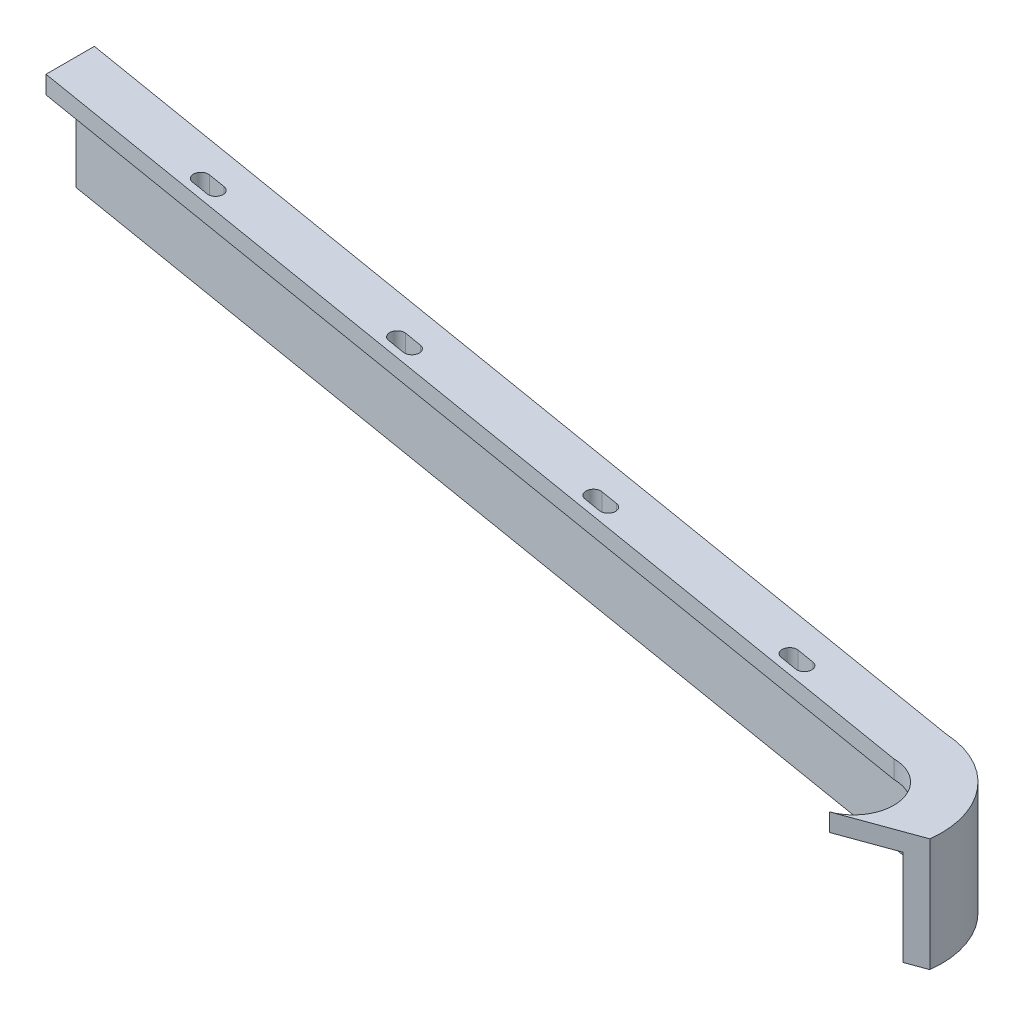
from build123d import *

# Parameters (mm, degrees)
SKETCH_1_W           = 35
SKETCH_1_H           = 55
EXTRUDE_1_DEPTH      = 1
EXTRUDE_2_DEPTH      = 3
SKETCH_3_R           = 5
CUT_EXTRUDE_1_DEPTH  = 169.569903897
SKETCH_4_R           = 4
CUT_EXTRUDE_2_DEPTH  = 2
SKETCH_5_R           = 2
CUT_EXTRUDE_3_DEPTH  = 2
EXTRUDE_START        = 7
EXTRUDE_3_DEPTH      = 7
CUT_EXTRUDE_START    = -1.5
SKETCH_9_W           = 10
SKETCH_9_H           = 26
CUT_EXTRUDE_4_DEPTH  = 168.318874833
SKETCH_10_R          = 1.5
CUT_EXTRUDE_5_DEPTH  = 194.595583627
EXTRUDE_4_DEPTH      = 3
SKETCH_13_W          = 334.012533363
SKETCH_13_H          = 161.456209481
CUT_EXTRUDE_6_DEPTH  = 10
SKETCH_14_R          = 3.5
CUT_EXTRUDE_7_DEPTH  = 2.5
SKETCH_15_R          = 5
CUT_EXTRUDE_8_DEPTH  = 179.854165453
EXTRUDE_START_2      = 16
EXTRUDE_5_DEPTH      = 16
EXTRUDE_6_DEPTH      = 7
SKETCH_19_W          = 10
SKETCH_19_H          = 26
CUT_EXTRUDE_9_DEPTH  = 180.209193181
SKETCH_20_R          = 1.5
CUT_EXTRUDE_10_DEPTH = 175.844216376
THREAD_1_PITCH       = 0.6
CUT_EXTRUDE_11_DEPTH = 181.709193232
SKETCH_22_W          = 13
SKETCH_22_H          = 1.5
CUT_EXTRUDE_12_DEPTH = 7
SKETCH_23_R          = 5
EXTRUDE_7_DEPTH      = 2
CUT_EXTRUDE_START_2  = -3
CUT_EXTRUDE_15_DEPTH = 177.762490825
SKETCH_25_R          = 7.5
CUT_EXTRUDE_16_DEPTH = 4
CUT_EXTRUDE_17_DEPTH = 10
SKETCH_27_R          = 1.75
CUT_EXTRUDE_18_DEPTH = 10
CUT_EXTRUDE_19_DEPTH = 180.762490825
CUT_EXTRUDE_START_3  = -10
SKETCH_29_R          = 3.5
CUT_EXTRUDE_23_DEPTH = 10
CUT_EXTRUDE_24_DEPTH = 10


with BuildPart() as part:
    # Sketch 1 → 凸台-拉伸1 (new body)
    with BuildSketch(Plane(origin=(0, 0, 0), x_dir=(1, 0, 0), z_dir=(0, 1, 0))):
        Rectangle(SKETCH_1_W, SKETCH_1_H)
    extrude(amount=EXTRUDE_1_DEPTH)

    # 草图2 → 凸台-拉伸2 (add)
    with BuildSketch(Plane(origin=(0, 1, 0), x_dir=(1, 0, 0), z_dir=(0, 1, 0))):
        with BuildLine():
            Line((106.75, -2.25), (106.75, 2.25))
            Line((106.75, 2.25), (121.75, 2.25))
            ThreePointArc((121.75, 2.25), (122.922125199, 2.352547667), (124.058635967, 2.65707481))
            Line((124.058635967, 2.65707481), (154.058635967, 13.576181838))
            ThreePointArc((154.058635967, 13.576181838), (158.397452333, 21.091232227), (151.75, 26.669107028))
            Line((151.75, 26.669107028), (-31.447415548, 57.101298968))
            ThreePointArc((-31.447415548, 57.101298968), (-37.800418235, 56.264673928), (-42.609265279, 52.029632639))
            Line((-42.609265279, 52.029632639), (-60.161792173, 23.605896086))
            ThreePointArc((-60.161792173, 23.605896086), (-61.717833724, 20.073278016), (-62.25, 16.25))
            Line((-62.25, 16.25), (-62.25, -16.25))
            ThreePointArc((-62.25, -16.25), (-61.717833724, -20.073278016), (-60.161792173, -23.605896086))
            Line((-60.161792173, -23.605896086), (-42.609265279, -52.029632639))
            ThreePointArc((-42.609265279, -52.029632639), (-37.800418235, -56.264673928), (-31.447415548, -57.101298968))
            Line((-31.447415548, -57.101298968), (151.75, -26.669107028))
            ThreePointArc((151.75, -26.669107028), (158.397452333, -21.091232227), (154.058635967, -13.576181838))
            Line((154.058635967, -13.576181838), (124.058635967, -2.65707481))
            ThreePointArc((124.058635967, -2.65707481), (122.922125199, -2.352547667), (121.75, -2.25))
            Line((121.75, -2.25), (106.75, -2.25))
        make_face()
    extrude(amount=EXTRUDE_2_DEPTH)

    # 草图3 → 切除-拉伸1 (cut, through all)
    with BuildSketch(Plane(origin=(0, 4, 0), x_dir=(1, 0, 0), z_dir=(0, 1, 0))):
        with Locations(Location((-48.25, 16.25, 0), (0, 0, 270))):
            Circle(SKETCH_3_R)
        with Locations(Location((-48.25, -16.25, 0), (0, 0, 270))):
            Circle(SKETCH_3_R)
    extrude(amount=-CUT_EXTRUDE_1_DEPTH, mode=Mode.SUBTRACT)

    # 草图4 → 切除-拉伸2 (cut)
    with BuildSketch(Plane(origin=(0, 4, 0), x_dir=(1, 0, 0), z_dir=(0, 1, 0))):
        with Locations(Location((-33.25, 46.25, 0), (0, 0, 270))):
            Circle(SKETCH_4_R)
        with Locations(Location((-33.25, -46.25, 0), (0, 0, 270))):
            Circle(SKETCH_4_R)
    extrude(amount=-CUT_EXTRUDE_2_DEPTH, mode=Mode.SUBTRACT)

    # 草图5 → 切除-拉伸3 (cut)
    with BuildSketch(Plane(origin=(0, 4, 0), x_dir=(1, 0, 0), z_dir=(0, 1, 0))):
        with Locations(Location((121.75, 9, 0), (0, 0, 270))):
            Circle(SKETCH_5_R)
        with Locations(Location((121.75, -9, 0), (0, 0, 270))):
            Circle(SKETCH_5_R)
        with Locations(Location((151.75, 19.919107028, 0), (0, 0, 270))):
            Circle(SKETCH_5_R)
        with Locations(Location((151.75, -19.919107028, 0), (0, 0, 270))):
            Circle(SKETCH_5_R)
    extrude(amount=-CUT_EXTRUDE_3_DEPTH, mode=Mode.SUBTRACT)

    # 草图8 → 凸台-拉伸3 (add)
    with BuildSketch(Plane.XZ.offset(-1).offset(EXTRUDE_START)):
        with BuildLine():
            Line((-26.75, -26.25), (-39.75, -26.25))
            Line((-39.75, -26.25), (-39.75, -55.124119675))
            ThreePointArc((-39.75, -55.124119675), (-35.798281322, -56.950759894), (-31.447415548, -57.101298968))
            Line((-31.447415548, -57.101298968), (-26.75, -56.320978726))
            Line((-26.75, -56.320978726), (-26.75, -26.25))
        make_face()
    extrude_3 = extrude(amount=-EXTRUDE_3_DEPTH)

    # 镜向1: 凸台-拉伸3 across plane
    add(extrude_3.mirror(Plane.XY))

    # 草图9 → 切除-拉伸4 (cut, through all)
    with BuildSketch(Plane.XZ.offset(6).offset(CUT_EXTRUDE_START)):
        with Locations((-33.25, -40.75)):
            Rectangle(SKETCH_9_W, SKETCH_9_H)
    cut_extrude_4 = extrude(amount=-CUT_EXTRUDE_4_DEPTH, mode=Mode.SUBTRACT)

    # 镜向2: 切除-拉伸4 across plane
    add(cut_extrude_4.mirror(Plane.XY), mode=Mode.SUBTRACT)

    # 草图10 → 切除-拉伸5 (cut, through all)
    with BuildSketch(Plane.XY.offset(-53.75)):
        with Locations((-33.25, -1.5)):
            Circle(SKETCH_10_R)
    cut_extrude_5 = extrude(amount=-CUT_EXTRUDE_5_DEPTH, mode=Mode.SUBTRACT)

    # 镜向3: 切除-拉伸5 across plane
    add(cut_extrude_5.mirror(Plane.XY), mode=Mode.SUBTRACT)

    # 草图12 → 凸台-拉伸4 (add)
    with BuildSketch(Plane(origin=(0, 4, 0), x_dir=(1, 0, 0), z_dir=(0, 1, 0))):
        with BuildLine():
            Line((152.536154407, 34.648141662), (-30.136445037, 64.993152763))
            ThreePointArc((-30.136445037, 64.993152763), (-32.296727103, 65.226071005), (-34.469475839, 65.210824842))
            Line((-34.469475839, 65.210824842), (-60.161792173, 23.605896086))
            ThreePointArc((-60.161792173, 23.605896086), (-61.717833724, 20.073278016), (-62.25, 16.25))
            Line((-62.25, 16.25), (-62.25, 2.25))
            Line((-62.25, 2.25), (121.75, 2.25))
            ThreePointArc((121.75, 2.25), (122.922125199, 2.352547667), (124.058635967, 2.65707481))
            Line((124.058635967, 2.65707481), (166.382589153, 18.061733966))
            ThreePointArc((166.382589153, 18.061733966), (163.073058037, 29.371665237), (152.536154407, 34.648141662))
        make_face()
    extrude(amount=EXTRUDE_4_DEPTH)

    # 草图13 → 切除-拉伸6 (cut)
    with BuildSketch(Plane.XZ.offset(-4)):
        with Locations((47.836319436, 6.16656882)):
            Rectangle(SKETCH_13_W, SKETCH_13_H)
    extrude(amount=CUT_EXTRUDE_6_DEPTH, mode=Mode.SUBTRACT)

    # 草图14 → 切除-拉伸7 (cut)
    with BuildSketch(Plane.XZ.offset(-4)):
        with Locations(Location((151.75, -19.919107028, 0), (0, 0, 270))):
            Circle(SKETCH_14_R)
        with Locations(Location((121.75, -9, 0), (0, 0, 270))):
            Circle(SKETCH_14_R)
    extrude(amount=-CUT_EXTRUDE_7_DEPTH, mode=Mode.SUBTRACT)

    # 草图15 → 切除-拉伸8 (cut, through all)
    with BuildSketch(Plane.XZ.offset(-4)):
        with Locations(Location((-48.25, -16.25, 0), (0, 0, 270))):
            Circle(SKETCH_15_R)
    extrude(amount=-CUT_EXTRUDE_8_DEPTH, mode=Mode.SUBTRACT)

    # 草图17 → 凸台-拉伸5 (add)
    with BuildSketch(Plane.XZ.offset(-4).offset(EXTRUDE_START_2)):
        with BuildLine():
            Line((-30.628058978, -62.03370759), (152.218782473, -31.659751942))
            ThreePointArc((152.218782473, -31.659751942), (161.216553887, -26.879484712), (163.096310198, -16.865626245))
            Line((163.096310198, -16.865626245), (166.382589153, -18.061733966))
            ThreePointArc((166.382589153, -18.061733966), (163.073058037, -29.371665237), (152.536154407, -34.648141662))
            Line((152.536154407, -34.648141662), (-30.136445037, -64.993152763))
            ThreePointArc((-30.136445037, -64.993152763), (-32.296727103, -65.226071005), (-34.469475839, -65.210824842))
            Line((-34.469475839, -65.210824842), (-36.504423199, -61.915526791))
            ThreePointArc((-36.504423199, -61.915526791), (-33.571714316, -62.246765295), (-30.628058978, -62.03370759))
        make_face()
    extrude(amount=-EXTRUDE_5_DEPTH)

    # 草图18 → 凸台-拉伸6 (add)
    with BuildSketch(Plane(origin=(0, 7, 0), x_dir=(1, 0, 0), z_dir=(0, 1, 0))):
        with BuildLine():
            Line((-39.75, 56.65979236), (-39.75, 26.25))
            Line((-39.75, 26.25), (-26.75, 26.25))
            Line((-26.75, 26.25), (-26.75, 64.430606916))
            Line((-26.75, 64.430606916), (-30.136445037, 64.993152763))
            ThreePointArc((-30.136445037, 64.993152763), (-32.296727103, 65.226071005), (-34.469475839, 65.210824842))
            Line((-34.469475839, 65.210824842), (-39.75, 56.65979236))
        make_face()
    extrude(amount=EXTRUDE_6_DEPTH)

    # 草图19 → 切除-拉伸9 (cut, through all)
    with BuildSketch(Plane(origin=(0, 14, 0), x_dir=(1, 0, 0), z_dir=(0, 1, 0)).offset(CUT_EXTRUDE_START)):
        with Locations((-33.25, 40.75)):
            Rectangle(SKETCH_19_W, SKETCH_19_H)
    extrude(amount=-CUT_EXTRUDE_9_DEPTH, mode=Mode.SUBTRACT)

    # 草图20 → 切除-拉伸10 (cut, through all)
    with BuildSketch(Plane.XY.offset(-53.75)):
        with Locations((-33.25, 9.5)):
            Circle(SKETCH_20_R)
    extrude(amount=-CUT_EXTRUDE_10_DEPTH, mode=Mode.SUBTRACT)

    # 螺纹线1: the profile of Sketch 1 2 profile screwed along a right-hand helix of 25 turns, 6 arcs to a turn; built about Z, then put on its axis
    thread_1_z = Axis((0, 0, 0), (0, 0, 1))
    thread_1_corners = [(1.4997, 0, -0.000173205), (1.824759525, 0, 0.187499999), (1.824759525, 0, 0.262499999), (1.4997, 0, 0.450173203)]
    with BuildLine(mode=Mode.PRIVATE) as thread_1_profile:
        Line(thread_1_corners[0], thread_1_corners[1])
        Line(thread_1_corners[1], thread_1_corners[2])
        Line(thread_1_corners[2], thread_1_corners[3])
        Line(thread_1_corners[3], thread_1_corners[0])
    thread_1_cap = Face(thread_1_profile.wire())
    thread_1_turn_angles = [0, 30, 60, 90, 120, 150, 180, 210, 240, 270, 300, 330, 360]
    thread_1_turn_weights = [1, 0.8660254037844387, 1, 0.8660254037844387, 1, 0.8660254037844387, 1, 0.8660254037844387, 1, 0.8660254037844387, 1, 0.8660254037844387, 1]
    thread_1_turn_rails = [Edge.make_bspline([Vector(p[0], p[1], 0).rotate(thread_1_z, thread_1_turn_angles[k]) / thread_1_turn_weights[k] + Vector(0, 0, p[2] + THREAD_1_PITCH * thread_1_turn_angles[k] / 360) for k in range(13)], [0, 0, 0, 1, 1, 2, 2, 3, 3, 4, 4, 5, 5, 6, 6, 6], 2, thread_1_turn_weights) for p in thread_1_corners]
    thread_1_turn_sides = [Face.make_surface_from_curves(thread_1_turn_rails[p[0]], thread_1_turn_rails[p[1]]) for p in [(0, 1), (1, 2), (2, 3), (3, 0)]]
    thread_1 = Plane(origin=(-33.25, 9.5, -53.75), x_dir=(-1, 0, 0), z_dir=(0, 0, -1)) * Solid(Shell([*[p.moved(Location((0, 0, THREAD_1_PITCH * i))) for i in range(25) for p in thread_1_turn_sides], thread_1_cap, thread_1_cap.rotate(thread_1_z, 9000).moved(Location((0, 0, THREAD_1_PITCH * 9000 / 360)))]))
    add(thread_1, mode=Mode.SUBTRACT)

    # 草图21 → 切除-拉伸11 (cut, through all)
    with BuildSketch(Plane(origin=(0, 14, 0), x_dir=(1, 0, 0), z_dir=(0, 1, 0))):
        with BuildLine():
            Line((-39.75, 27.75), (-26.75, 27.75))
            Line((-26.75, 27.75), (-26.75, 64.430606916))
            Line((-26.75, 64.430606916), (-30.136445037, 64.993152763))
            ThreePointArc((-30.136445037, 64.993152763), (-32.296727103, 65.226071005), (-34.469475839, 65.210824842))
            Line((-34.469475839, 65.210824842), (-39.75, 56.65979236))
            Line((-39.75, 56.65979236), (-39.75, 27.75))
        make_face()
    extrude(amount=-CUT_EXTRUDE_11_DEPTH, mode=Mode.SUBTRACT)

    # 草图22 → 切除-拉伸12 (cut)
    with BuildSketch(Plane(origin=(0, 14, 0), x_dir=(1, 0, 0), z_dir=(0, 1, 0))):
        with Locations((-33.25, 27)):
            Rectangle(SKETCH_22_W, SKETCH_22_H)
    extrude(amount=-CUT_EXTRUDE_12_DEPTH, mode=Mode.SUBTRACT)

    # 草图23 → 凸台-拉伸7 (add)
    with BuildSketch(Plane(origin=(0, 7, 0), x_dir=(1, 0, 0), z_dir=(0, 1, 0))):
        with BuildLine():
            Line((-26.75, 27.75), (-39.75, 27.75))
            Line((-39.75, 27.75), (-39.75, 56.65979236))
            Line((-39.75, 56.65979236), (-60.161792173, 23.605896086))
            ThreePointArc((-60.161792173, 23.605896086), (-61.717833724, 20.073278016), (-62.25, 16.25))
            Line((-62.25, 16.25), (-62.25, 2.25))
            Line((-62.25, 2.25), (-18.75, 2.25))
            Line((-18.75, 2.25), (-18.75, 63.101671489))
            Line((-18.75, 63.101671489), (-26.75, 64.430606916))
            Line((-26.75, 64.430606916), (-26.75, 27.75))
        make_face()
        with Locations(Location((-48.25, 16.25, 0), (0, 0, 90))):
            Circle(SKETCH_23_R, mode=Mode.SUBTRACT)
    extrude(amount=EXTRUDE_7_DEPTH)

    # 草图24 → 切除-拉伸15 (cut, through all)
    with BuildSketch(Plane(origin=(0, 9, 0), x_dir=(1, 0, 0), z_dir=(0, 1, 0)).offset(CUT_EXTRUDE_START_2)):
        Polygon((-45.75, 46.034880297), (-45.75, 27.75), (-39.75, 27.75), (-39.75, 56.65979236), (-45.75, 46.943674541), align=None)
        Polygon((-26.75, 64.430606916), (-26.75, 27.75), (-20.75, 27.75), (-20.75, 63.433905346), align=None)
    extrude(amount=-CUT_EXTRUDE_15_DEPTH, mode=Mode.SUBTRACT)

    # 草图25 → 切除-拉伸16 (cut)
    with BuildSketch(Plane.XZ.offset(-4)):
        with Locations(Location((-48.25, -16.25, 0), (0, 0, 270))):
            Circle(SKETCH_25_R)
    extrude(amount=-CUT_EXTRUDE_16_DEPTH, mode=Mode.SUBTRACT)

    # 草图26 → 切除-拉伸17 (cut)
    with BuildSketch(Plane(origin=(0, 7, 0), x_dir=(1, 0, 0), z_dir=(0, 1, 0))):
        with BuildLine():
            Line((3.5, 31.25), (3.5, 35.25))
            ThreePointArc((3.5, 35.25), (1.75, 37), (0, 35.25))
            Line((0, 35.25), (0, 31.25))
            ThreePointArc((0, 31.25), (1.75, 29.5), (3.5, 31.25))
        make_face()
        with BuildLine():
            ThreePointArc((41.75, 18), (40.512563133, 17.487436867), (40, 16.25))
            Line((40, 16.25), (47.5, 16.25))
            ThreePointArc((47.5, 16.25), (46.987436867, 17.487436867), (45.75, 18))
            Line((45.75, 18), (41.75, 18))
        make_face()
        with BuildLine():
            Line((47.5, 16.25), (40, 16.25))
            ThreePointArc((40, 16.25), (40.512563133, 15.012563133), (41.75, 14.5))
            Line((41.75, 14.5), (45.75, 14.5))
            ThreePointArc((45.75, 14.5), (46.987436867, 15.012563133), (47.5, 16.25))
        make_face()
        with BuildLine():
            Line((81.75, 14.5), (85.75, 14.5))
            ThreePointArc((85.75, 14.5), (87.5, 16.25), (85.75, 18))
            Line((85.75, 18), (81.75, 18))
            ThreePointArc((81.75, 18), (80, 16.25), (81.75, 14.5))
        make_face()
        with BuildLine():
            Line((1.75, 18), (5.75, 18))
            ThreePointArc((5.75, 18), (7.5, 16.25), (5.75, 14.5))
            Line((5.75, 14.5), (1.75, 14.5))
            ThreePointArc((1.75, 14.5), (0, 16.25), (1.75, 18))
        make_face()
    extrude(amount=-CUT_EXTRUDE_17_DEPTH, mode=Mode.SUBTRACT)

    # 草图27 → 切除-拉伸18 (cut)
    with BuildSketch(Plane.XZ.offset(-6)):
        with Locations(Location((-42.75, -32.75, 0), (0, 0, 270))):
            Circle(SKETCH_27_R)
        with Locations(Location((-42.75, -42.75, 0), (0, 0, 270))):
            Circle(SKETCH_27_R)
        with Locations(Location((-23.75, -32.75, 0), (0, 0, 270))):
            Circle(SKETCH_27_R)
        with Locations(Location((-23.75, -42.75, 0), (0, 0, 270))):
            Circle(SKETCH_27_R)
    extrude(amount=-CUT_EXTRUDE_18_DEPTH, mode=Mode.SUBTRACT)

    # 草图28 → 切除-拉伸19 (cut, through all)
    with BuildSketch(Plane(origin=(0, 9, 0), x_dir=(1, 0, 0), z_dir=(0, 1, 0))):
        with BuildLine():
            Line((-26.75, 27.75), (-39.75, 27.75))
            Line((-39.75, 27.75), (-39.75, 56.65979236))
            Line((-39.75, 56.65979236), (-60.161792173, 23.605896086))
            ThreePointArc((-60.161792173, 23.605896086), (-61.717833724, 20.073278016), (-62.25, 16.25))
            Line((-62.25, 16.25), (-62.25, 2.25))
            Line((-62.25, 2.25), (-18.75, 2.25))
            Line((-18.75, 2.25), (-18.75, 63.101671489))
            Line((-18.75, 63.101671489), (-26.75, 64.430606916))
            Line((-26.75, 64.430606916), (-26.75, 27.75))
        make_face()
    extrude(amount=-CUT_EXTRUDE_19_DEPTH, mode=Mode.SUBTRACT)

    # 草图29 → 切除-拉伸23 (cut)
    # profile 1 of 3: a face of its own
    with BuildSketch(Plane.XZ.offset(-4).offset(CUT_EXTRUDE_START_3)):
        with BuildLine():
            Line((-18.75, -2.25), (-18.75, -54.9920433))
            Line((-18.75, -54.9920433), (151.75, -26.669107028))
            ThreePointArc((151.75, -26.669107028), (158.397452333, -21.091232227), (154.058635967, -13.576181838))
            Line((154.058635967, -13.576181838), (124.058635967, -2.65707481))
            ThreePointArc((124.058635967, -2.65707481), (122.922125199, -2.352547667), (121.75, -2.25))
            Line((121.75, -2.25), (-18.75, -2.25))
        make_face()
        with BuildLine():
            Line((0, -35.25), (0, -31.25))
            ThreePointArc((0, -31.25), (1.75, -29.5), (3.5, -31.25))
            Line((3.5, -31.25), (3.5, -35.25))
            ThreePointArc((3.5, -35.25), (1.75, -37), (0, -35.25))
        make_face(mode=Mode.SUBTRACT)
        with BuildLine():
            ThreePointArc((5.75, -14.5), (7.5, -16.25), (5.75, -18))
            Line((5.75, -18), (1.75, -18))
            ThreePointArc((1.75, -18), (0, -16.25), (1.75, -14.5))
            Line((1.75, -14.5), (5.75, -14.5))
        make_face(mode=Mode.SUBTRACT)
        with BuildLine():
            ThreePointArc((45.75, -14.5), (47.5, -16.25), (45.75, -18))
            Line((45.75, -18), (41.75, -18))
            ThreePointArc((41.75, -18), (40, -16.25), (41.75, -14.5))
            Line((41.75, -14.5), (45.75, -14.5))
        make_face(mode=Mode.SUBTRACT)
        with Locations((151.75, -19.919107028)):
            Circle(SKETCH_29_R, mode=Mode.SUBTRACT)
        with BuildLine():
            Line((85.75, -18), (81.75, -18))
            ThreePointArc((81.75, -18), (80, -16.25), (81.75, -14.5))
            Line((81.75, -14.5), (85.75, -14.5))
            ThreePointArc((85.75, -14.5), (87.5, -16.25), (85.75, -18))
        make_face(mode=Mode.SUBTRACT)
        with Locations((121.75, -9)):
            Circle(SKETCH_29_R, mode=Mode.SUBTRACT)
    # profile 2 of 3: a face of its own
    with BuildSketch(Plane.XZ.offset(-4).offset(CUT_EXTRUDE_START_3)):
        with Locations((121.75, -9)):
            Circle(SKETCH_29_R)
    # profile 3 of 3: a face of its own
    with BuildSketch(Plane.XZ.offset(-4).offset(CUT_EXTRUDE_START_3)):
        with Locations((151.75, -19.919107028)):
            Circle(SKETCH_29_R)
    extrude(amount=CUT_EXTRUDE_23_DEPTH, mode=Mode.SUBTRACT)

    # 草图30 → 切除-拉伸24 (cut)
    with BuildSketch(Plane.XZ.offset(-4)):
        with BuildLine():
            Line((9.159890002, -51.622867509), (12.119335175, -51.131253567))
            ThreePointArc((12.119335175, -51.131253567), (13.557276473, -52.15951658), (12.52901346, -53.597457878))
            Line((12.52901346, -53.597457878), (9.569568287, -54.08907182))
            ThreePointArc((9.569568287, -54.08907182), (8.131626989, -53.060808807), (9.159890002, -51.622867509))
        make_face()
        with BuildLine():
            Line((48.619158976, -45.068014955), (51.578604149, -44.576401013))
            ThreePointArc((51.578604149, -44.576401013), (53.016545447, -45.604664026), (51.988282434, -47.042605324))
            Line((51.988282434, -47.042605324), (49.028837261, -47.534219265))
            ThreePointArc((49.028837261, -47.534219265), (47.590895963, -46.505956252), (48.619158976, -45.068014955))
        make_face()
        with BuildLine():
            Line((88.078427951, -38.5131624), (91.037873124, -38.021548459))
            ThreePointArc((91.037873124, -38.021548459), (92.475814422, -39.049811472), (91.447551408, -40.48775277))
            Line((91.447551408, -40.48775277), (88.488106235, -40.979366711))
            ThreePointArc((88.488106235, -40.979366711), (87.050164938, -39.951103698), (88.078427951, -38.5131624))
        make_face()
        with BuildLine():
            Line((127.537696925, -31.958309846), (130.497142098, -31.466695904))
            ThreePointArc((130.497142098, -31.466695904), (131.935083396, -32.494958918), (130.906820383, -33.932900215))
            Line((130.906820383, -33.932900215), (127.94737521, -34.424514157))
            ThreePointArc((127.94737521, -34.424514157), (126.509433912, -33.396251144), (127.537696925, -31.958309846))
        make_face()
    extrude(amount=-CUT_EXTRUDE_24_DEPTH, mode=Mode.SUBTRACT)


solid = part.part
